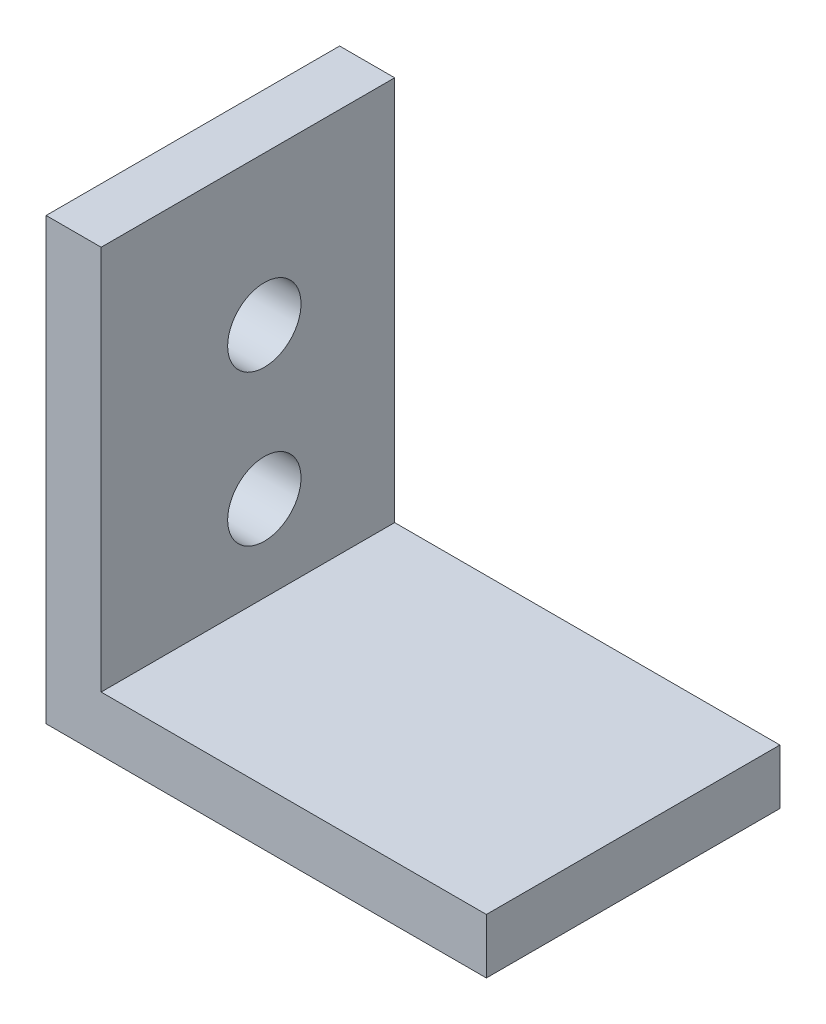
from build123d import *

# Parameters (mm, degrees)
BOSS_EXTRUDE1_DEPTH = 25.4
CUT_EXTRUDE1_REACH  = 51.636
SKETCH2_R           = 3.175


with BuildPart() as part:
    # Sketch1 → Boss-Extrude1 (new body)
    with BuildSketch(Plane.XY):
        Polygon((-23.771121012, 18.943273067), (-23.771121012, -19.156726933), (14.328878988, -19.156726933), (14.328878988, -14.394226933), (-19.008621012, -14.394226933), (-19.008621012, 18.943273067), align=None)
    extrude(amount=BOSS_EXTRUDE1_DEPTH)

    # Sketch2 → Cut-Extrude1 (cut, up to next)
    with BuildSketch(Plane.ZY.offset(23.771121012), mode=Mode.PRIVATE) as cut_extrude1_sk1:
        with Locations((11.277886176, 6.059245384)):
            Circle(SKETCH2_R)
    cut_extrude1_tool1 = extrude(cut_extrude1_sk1.sketch, amount=-CUT_EXTRUDE1_REACH, mode=Mode.PRIVATE) & part.part
    # Sketch2 → Cut-Extrude1 (cut, up to next)
    with BuildSketch(Plane.ZY.offset(23.771121012), mode=Mode.PRIVATE) as cut_extrude1_sk2:
        with Locations((11.277886176, -6.975543756)):
            Circle(SKETCH2_R)
    cut_extrude1_tool2 = extrude(cut_extrude1_sk2.sketch, amount=-CUT_EXTRUDE1_REACH, mode=Mode.PRIVATE) & part.part
    add(cut_extrude1_tool1.solids().sort_by_distance((-23.771121, 6.059245, 11.277886))[0], mode=Mode.SUBTRACT)
    add(cut_extrude1_tool2.solids().sort_by_distance((-23.771121, -6.975544, 11.277886))[0], mode=Mode.SUBTRACT)


solid = part.part
